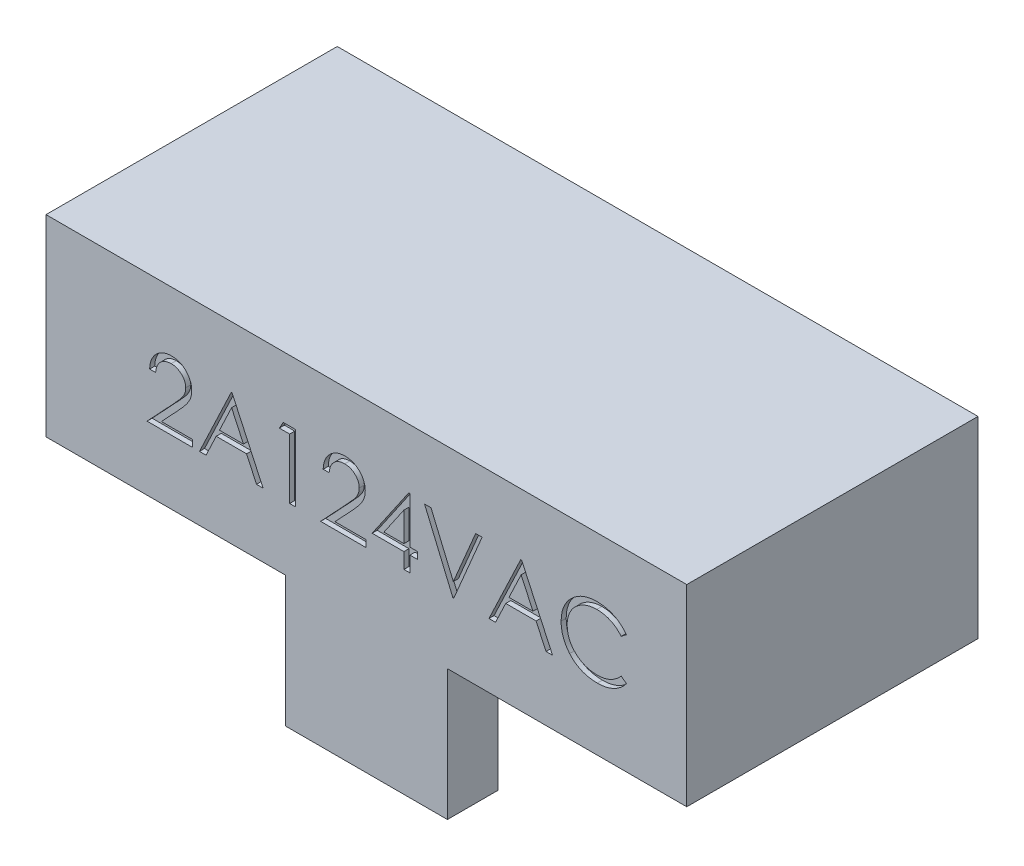
from build123d import *

# Parameters (mm, degrees)
SKETCH1_W      = 12.65
SKETCH1_H      = 3.8
EXTRUDE1_DEPTH = 5.75
SKETCH2_W      = 3.2
SKETCH2_H      = 2.58
EXTRUDE2_DEPTH = 1
SKETCH3_W      = 3.2
SKETCH3_H      = 2.58
EXTRUDE3_DEPTH = 1
WRAP1_START    = -4.1
WRAP1_DEPTH    = 0.1


# Read off the part's stored shape, not the designer's step: Wrap1
with BuildPart() as part:
    # Sketch1 → Extrude1 (new body)
    with BuildSketch(Plane.XY):
        Rectangle(SKETCH1_W, SKETCH1_H)
    extrude(amount=EXTRUDE1_DEPTH)

    # Sketch2 → Extrude2 (add)
    with BuildSketch(Plane.XY.offset(5.75)):
        with Locations((0, -3.19)):
            Rectangle(SKETCH2_W, SKETCH2_H)
    extrude(amount=-EXTRUDE2_DEPTH)

    # Sketch3 → Extrude3 (add)
    with BuildSketch(Plane(origin=(0, 0, 0), x_dir=(-1, 0, 0), z_dir=(0, 0, -1))):
        with Locations((0, -3.19)):
            Rectangle(SKETCH3_W, SKETCH3_H)
    extrude(amount=-EXTRUDE3_DEPTH)

    # Wrap1 outline → Wrap1 (cut)
    # profile 1 of 8: a face of its own
    with BuildSketch(Plane.XY.offset(9.75).offset(WRAP1_START)):
        with BuildLine():
            add(Edge.make_bspline(
                [(-4.279021285, 0.28237644), (-4.27824751, 0.298127044), (-4.276727836, 0.32906081), (-4.269611191, 0.374162405), (-4.259428181, 0.417272403), (-4.245030518, 0.458044663), (-4.227149872, 0.496839688), (-4.205707272, 0.533503384), (-4.180309596, 0.567895887), (-4.151505265, 0.599698367), (-4.12022069, 0.628873431), (-4.086465172, 0.654067525), (-4.050993986, 0.675354264), (-4.013914749, 0.693149853), (-3.974809119, 0.706507473), (-3.934031967, 0.716418629), (-3.891404139, 0.722381712), (-3.86236044, 0.723022678), (-3.847589327, 0.723348662)],
                knots=[0, 0, 0, 0, 0.068790794, 0.135103289, 0.198978674, 0.2619043, 0.323494969, 0.385195378, 0.446969239, 0.509764777, 0.572250569, 0.633405176, 0.693251163, 0.752583163, 0.812579266, 0.873275085, 0.935549943, 1, 1, 1, 1], degree=3))
            Line((-4.279021285, 0.28237644), (-4.160297994, 0.28237644))
            add(Edge.make_bspline(
                [(-3.853684496, 0.587664902), (-3.864030019, 0.587394637), (-3.884346918, 0.58686388), (-3.914176434, 0.583151147), (-3.942632665, 0.576746023), (-3.969787194, 0.567985792), (-3.995685966, 0.556851162), (-4.02020303, 0.542982556), (-4.043283348, 0.526433438), (-4.064970308, 0.50767049), (-4.084951634, 0.486780652), (-4.102507447, 0.463493553), (-4.117847238, 0.438234381), (-4.131231085, 0.411071292), (-4.142100051, 0.38175781), (-4.150405379, 0.350397993), (-4.156977193, 0.317128007), (-4.159172675, 0.294152692), (-4.160297994, 0.28237644)],
                knots=[0, 0, 0, 0, 0.064438672, 0.126546911, 0.186887153, 0.245877536, 0.304040885, 0.362191218, 0.420975933, 0.480660283, 0.540600275, 0.600689098, 0.66193579, 0.724442506, 0.789038394, 0.856313757, 0.926352028, 1, 1, 1, 1], degree=3))
            add(Edge.make_bspline(
                [(-3.566681541, 0.319477469), (-3.566921837, 0.328504069), (-3.567395413, 0.346293764), (-3.571574959, 0.372376298), (-3.577891133, 0.397536212), (-3.58694187, 0.421850899), (-3.598888465, 0.445075892), (-3.613430487, 0.467239464), (-3.630208874, 0.488666543), (-3.649618431, 0.508757224), (-3.670940643, 0.52715756), (-3.69346585, 0.543457438), (-3.717297288, 0.557079364), (-3.742334477, 0.568246102), (-3.768507616, 0.577005845), (-3.795867326, 0.583075605), (-3.824338011, 0.586886544), (-3.843778648, 0.587402169), (-3.853684496, 0.587664902)],
                knots=[0, 0, 0, 0, 0.061965401, 0.122121906, 0.180988497, 0.239933216, 0.299905831, 0.359988847, 0.421775742, 0.486575826, 0.551534805, 0.615017543, 0.677258617, 0.739729962, 0.803050103, 0.866495132, 0.931973474, 1, 1, 1, 1], degree=3))
            add(Edge.make_bspline(
                [(-3.816848475, -0.085983769), (-3.804357161, -0.072944231), (-3.780363902, -0.047897946), (-3.746428226, -0.011331411), (-3.715948608, 0.022591779), (-3.688727749, 0.053807528), (-3.665356156, 0.082772436), (-3.644615759, 0.10854841), (-3.627997812, 0.132268098), (-3.609962528, 0.159762318), (-3.592494744, 0.19333126), (-3.577484419, 0.23435441), (-3.568331783, 0.276584651), (-3.567233824, 0.305122624), (-3.566681541, 0.319477469)],
                knots=[0, 0, 0, 0, 0.110802644, 0.212829202, 0.30610131, 0.390647321, 0.466924469, 0.534481039, 0.593586941, 0.644557005, 0.736200453, 0.825024026, 0.911985585, 1, 1, 1, 1], degree=3))
            Line((-3.816848475, -0.085983769), (-4.329902695, -0.633488944))
            Line((-4.329902695, -0.633488944), (-3.430997781, -0.633488944))
            Line((-3.430997781, -0.633488944), (-3.430997781, -0.497805184))
            Line((-3.430997781, -0.497805184), (-4.046609843, -0.497805184))
            Line((-4.046609843, -0.497805184), (-3.715615669, -0.144550393))
            add(Edge.make_bspline(
                [(-3.447958251, 0.330077762), (-3.448598264, 0.311652242), (-3.449867059, 0.275124542), (-3.460720409, 0.221446305), (-3.477671323, 0.169439269), (-3.498081038, 0.127583205), (-3.518670325, 0.093855069), (-3.537224234, 0.066085648), (-3.558944564, 0.036185664), (-3.584147449, 0.004255242), (-3.61231154, -0.029955725), (-3.643691941, -0.06642657), (-3.678512424, -0.104780483), (-3.702951798, -0.130976351), (-3.715615669, -0.144550393)],
                knots=[0, 0, 0, 0, 0.098702196, 0.195672309, 0.292422427, 0.391342544, 0.444462441, 0.504228775, 0.570352338, 0.642545753, 0.722287505, 0.807921123, 0.900469538, 1, 1, 1, 1], degree=3))
            add(Edge.make_bspline(
                [(-3.847589327, 0.723348662), (-3.833083329, 0.723009067), (-3.804579561, 0.722341775), (-3.76297874, 0.716611267), (-3.723375417, 0.707635999), (-3.685847005, 0.695043564), (-3.650692927, 0.678116117), (-3.617649098, 0.657781928), (-3.586322125, 0.634264314), (-3.558122537, 0.606576116), (-3.532228114, 0.577017477), (-3.509888869, 0.545461037), (-3.490758298, 0.51286842), (-3.47481236, 0.478991094), (-3.463073879, 0.44351008), (-3.454161877, 0.406941941), (-3.449124432, 0.368908158), (-3.448351311, 0.343165502), (-3.447958251, 0.330077762)],
                knots=[0, 0, 0, 0, 0.06947546, 0.136516798, 0.200788824, 0.263829673, 0.325735023, 0.387290692, 0.449509219, 0.51296782, 0.576275215, 0.6375801, 0.697902606, 0.757172088, 0.816598528, 0.876653171, 0.937289642, 1, 1, 1, 1], degree=3))
        make_face()
    # profile 2 of 8: a face of its own
    with BuildSketch(Plane.XY.offset(9.75).offset(WRAP1_START)):
        with BuildLine():
            add(Edge.make_bspline(
                [(-0.853006328, 0.28237644), (-0.852232553, 0.298127044), (-0.850712879, 0.32906081), (-0.843596234, 0.374162405), (-0.833413224, 0.417272403), (-0.819015561, 0.458044663), (-0.801134914, 0.496839688), (-0.779692315, 0.533503384), (-0.754294639, 0.567895887), (-0.725490308, 0.599698367), (-0.694205733, 0.628873431), (-0.660450214, 0.654067525), (-0.624979028, 0.675354264), (-0.587899791, 0.693149853), (-0.548794162, 0.706507473), (-0.50801701, 0.716418629), (-0.465389182, 0.722381712), (-0.436345483, 0.723022678), (-0.42157437, 0.723348662)],
                knots=[0, 0, 0, 0, 0.068790794, 0.135103289, 0.198978674, 0.2619043, 0.323494969, 0.385195378, 0.446969239, 0.509764777, 0.572250569, 0.633405176, 0.693251163, 0.752583163, 0.812579266, 0.873275085, 0.935549943, 1, 1, 1, 1], degree=3))
            Line((-0.853006328, 0.28237644), (-0.734283037, 0.28237644))
            add(Edge.make_bspline(
                [(-0.427669539, 0.587664902), (-0.438015062, 0.587394637), (-0.458331961, 0.58686388), (-0.488161476, 0.583151147), (-0.516617708, 0.576746023), (-0.543772237, 0.567985792), (-0.569671009, 0.556851162), (-0.594188073, 0.542982556), (-0.617268391, 0.526433438), (-0.638955351, 0.50767049), (-0.658936676, 0.486780652), (-0.67649249, 0.463493553), (-0.691832281, 0.438234381), (-0.705216128, 0.411071292), (-0.716085094, 0.38175781), (-0.724390422, 0.350397993), (-0.730962236, 0.317128007), (-0.733157718, 0.294152692), (-0.734283037, 0.28237644)],
                knots=[0, 0, 0, 0, 0.064438672, 0.126546911, 0.186887153, 0.245877536, 0.304040885, 0.362191218, 0.420975933, 0.480660283, 0.540600275, 0.600689098, 0.66193579, 0.724442506, 0.789038394, 0.856313757, 0.926352028, 1, 1, 1, 1], degree=3))
            add(Edge.make_bspline(
                [(-0.140666584, 0.319477469), (-0.14090688, 0.328504069), (-0.141380456, 0.346293764), (-0.145560002, 0.372376298), (-0.151876176, 0.397536212), (-0.160926913, 0.421850899), (-0.172873508, 0.445075892), (-0.18741553, 0.467239464), (-0.204193917, 0.488666543), (-0.223603474, 0.508757224), (-0.244925685, 0.52715756), (-0.267450893, 0.543457438), (-0.291282331, 0.557079364), (-0.31631952, 0.568246102), (-0.342492659, 0.577005845), (-0.369852369, 0.583075605), (-0.398323054, 0.586886544), (-0.41776369, 0.587402169), (-0.427669539, 0.587664902)],
                knots=[0, 0, 0, 0, 0.061965401, 0.122121906, 0.180988497, 0.239933216, 0.299905831, 0.359988847, 0.421775742, 0.486575826, 0.551534805, 0.615017543, 0.677258617, 0.739729962, 0.803050103, 0.866495132, 0.931973474, 1, 1, 1, 1], degree=3))
            add(Edge.make_bspline(
                [(-0.390833518, -0.085983769), (-0.378342203, -0.072944231), (-0.354348945, -0.047897946), (-0.320413269, -0.011331411), (-0.289933651, 0.022591779), (-0.262712791, 0.053807528), (-0.239341198, 0.082772436), (-0.218600801, 0.10854841), (-0.201982855, 0.132268098), (-0.183947571, 0.159762318), (-0.166479787, 0.19333126), (-0.151469462, 0.23435441), (-0.142316825, 0.276584651), (-0.141218867, 0.305122624), (-0.140666584, 0.319477469)],
                knots=[0, 0, 0, 0, 0.110802644, 0.212829202, 0.30610131, 0.390647321, 0.466924469, 0.534481039, 0.593586941, 0.644557005, 0.736200453, 0.825024026, 0.911985585, 1, 1, 1, 1], degree=3))
            Line((-0.390833518, -0.085983769), (-0.903887738, -0.633488944))
            Line((-0.903887738, -0.633488944), (-0.004982823, -0.633488944))
            Line((-0.004982823, -0.633488944), (-0.004982823, -0.497805184))
            Line((-0.004982823, -0.497805184), (-0.620594886, -0.497805184))
            Line((-0.620594886, -0.497805184), (-0.289600712, -0.144550393))
            add(Edge.make_bspline(
                [(-0.021943293, 0.330077762), (-0.022583307, 0.311652242), (-0.023852101, 0.275124542), (-0.034705452, 0.221446305), (-0.051656365, 0.169439269), (-0.072066081, 0.127583205), (-0.092655367, 0.093855069), (-0.111209277, 0.066085648), (-0.132929607, 0.036185664), (-0.158132492, 0.004255242), (-0.186296583, -0.029955725), (-0.217676984, -0.06642657), (-0.252497467, -0.104780483), (-0.276936841, -0.130976351), (-0.289600712, -0.144550393)],
                knots=[0, 0, 0, 0, 0.098702196, 0.195672309, 0.292422427, 0.391342544, 0.444462441, 0.504228775, 0.570352338, 0.642545753, 0.722287505, 0.807921123, 0.900469538, 1, 1, 1, 1], degree=3))
            add(Edge.make_bspline(
                [(-0.42157437, 0.723348662), (-0.407068372, 0.723009067), (-0.378564603, 0.722341775), (-0.336963782, 0.716611267), (-0.29736046, 0.707635999), (-0.259832048, 0.695043564), (-0.22467797, 0.678116117), (-0.191634141, 0.657781928), (-0.160307167, 0.634264314), (-0.13210758, 0.606576116), (-0.106213157, 0.577017477), (-0.083873912, 0.545461037), (-0.064743341, 0.51286842), (-0.048797402, 0.478991094), (-0.037058921, 0.44351008), (-0.02814692, 0.406941941), (-0.023109475, 0.368908158), (-0.022336354, 0.343165502), (-0.021943293, 0.330077762)],
                knots=[0, 0, 0, 0, 0.06947546, 0.136516798, 0.200788824, 0.263829673, 0.325735023, 0.387290692, 0.449509219, 0.51296782, 0.576275215, 0.6375801, 0.697902606, 0.757172088, 0.816598528, 0.876653171, 0.937289642, 1, 1, 1, 1], degree=3))
        make_face()
    # profile 3 of 8: a face of its own
    with BuildSketch(Plane.XY.offset(9.75).offset(WRAP1_START)):
        with BuildLine():
            add(Edge.make_bspline(
                [(5.030156733, 0.367178791), (5.022746174, 0.376010571), (5.008024967, 0.39355506), (4.98434128, 0.418191376), (4.959658814, 0.441272591), (4.933987003, 0.462908658), (4.906863764, 0.482342972), (4.878946141, 0.500588299), (4.849767118, 0.516942474), (4.809417504, 0.536772234), (4.756633942, 0.557464977), (4.690187679, 0.574815305), (4.620824853, 0.585860214), (4.573503141, 0.587056449), (4.549433409, 0.587664902)],
                knots=[0, 0, 0, 0, 0.063163259, 0.125474941, 0.18712122, 0.248294346, 0.309294856, 0.369850066, 0.430973376, 0.49245599, 0.616147966, 0.740843698, 0.868182649, 1, 1, 1, 1], degree=3))
            Line((5.030156733, 0.367178791), (5.134039613, 0.446680994))
            add(Edge.make_bspline(
                [(4.556853615, 0.723348662), (4.572053728, 0.723166426), (4.602140821, 0.722805706), (4.64664852, 0.719288206), (4.68998059, 0.713424432), (4.732166883, 0.705443061), (4.773412634, 0.695537317), (4.813402606, 0.682633097), (4.852371455, 0.667878218), (4.890073411, 0.650884988), (4.926327584, 0.631809762), (4.96112268, 0.610863975), (4.994182314, 0.588073597), (5.025739111, 0.563632456), (5.055265179, 0.537023477), (5.083598833, 0.508978552), (5.109777872, 0.478689874), (5.125937561, 0.457370152), (5.134039613, 0.446680994)],
                knots=[0, 0, 0, 0, 0.068547537, 0.135682946, 0.20121499, 0.265682235, 0.329266835, 0.392395428, 0.455069762, 0.51712685, 0.578790035, 0.639739863, 0.700191504, 0.759806243, 0.819628319, 0.879354791, 0.939511608, 1, 1, 1, 1], degree=3))
            add(Edge.make_bspline(
                [(3.845043886, 0.035654602), (3.845631712, 0.059450264), (3.846788223, 0.106266745), (3.856614015, 0.174972971), (3.872420524, 0.240798054), (3.894871134, 0.303619112), (3.923334764, 0.363766569), (3.958496609, 0.420780953), (3.999948178, 0.475026886), (4.047364371, 0.525681271), (4.099361549, 0.571998229), (4.155044553, 0.612746407), (4.214304396, 0.646657492), (4.276488227, 0.675004256), (4.342061684, 0.69679249), (4.410884862, 0.712045034), (4.48282844, 0.721538706), (4.531913345, 0.722738859), (4.556853615, 0.723348662)],
                knots=[0, 0, 0, 0, 0.064557846, 0.127013532, 0.18795481, 0.248013913, 0.307747682, 0.368234515, 0.429469844, 0.492743437, 0.556257769, 0.618216786, 0.679655476, 0.741245546, 0.803415265, 0.866815462, 0.932328312, 1, 1, 1, 1], degree=3))
            add(Edge.make_bspline(
                [(4.012793535, -0.436058472), (3.999399706, -0.41960094), (3.972773749, -0.386884564), (3.938708386, -0.333859803), (3.909548447, -0.278498308), (3.885971834, -0.220509227), (3.867540682, -0.160022685), (3.854772195, -0.09700819), (3.846475011, -0.031524593), (3.845526182, 0.013014908), (3.845043886, 0.035654602)],
                knots=[0, 0, 0, 0, 0.12432851, 0.247156016, 0.368779749, 0.490733862, 0.613613772, 0.738957576, 0.867310575, 1, 1, 1, 1], degree=3))
            add(Edge.make_bspline(
                [(4.558443659, -0.667409885), (4.544215249, -0.667310858), (4.516080331, -0.667115044), (4.474541219, -0.663943005), (4.434101705, -0.659615277), (4.394877367, -0.653098918), (4.356654156, -0.645409241), (4.319778578, -0.635101356), (4.28388777, -0.623554498), (4.249125927, -0.609983268), (4.21546348, -0.594669116), (4.183009004, -0.577360997), (4.151777424, -0.558204459), (4.121461685, -0.537621761), (4.092509622, -0.514951769), (4.064670343, -0.490509321), (4.03778774, -0.464376799), (4.021155773, -0.445532852), (4.012793535, -0.436058472)],
                knots=[0, 0, 0, 0, 0.069662801, 0.137749562, 0.203916744, 0.268779862, 0.332413706, 0.39475354, 0.456180032, 0.516995649, 0.577395938, 0.637198344, 0.696999184, 0.756756194, 0.816553905, 0.876947997, 0.938131788, 1, 1, 1, 1], degree=3))
            add(Edge.make_bspline(
                [(5.134039613, -0.389947194), (5.125679494, -0.40073405), (5.1089993, -0.422256092), (5.081989871, -0.452596887), (5.053536845, -0.481135615), (5.023428883, -0.507642186), (4.992012337, -0.532646999), (4.9587231, -0.555439655), (4.923998793, -0.576338293), (4.88795707, -0.595474065), (4.850636226, -0.612451715), (4.812080978, -0.626986324), (4.772457516, -0.639506743), (4.73176403, -0.649807326), (4.68991611, -0.65784729), (4.64706477, -0.663221988), (4.603117525, -0.6669042), (4.573468536, -0.667239811), (4.558443659, -0.667409885)],
                knots=[0, 0, 0, 0, 0.061674239, 0.123053062, 0.183475001, 0.243726501, 0.304278917, 0.364862921, 0.425946204, 0.48739123, 0.549220384, 0.611143589, 0.67352853, 0.736961457, 0.800785283, 0.866012596, 0.932100748, 1, 1, 1, 1], degree=3))
            Line((5.134039613, -0.389947194), (5.030156733, -0.311240013))
            add(Edge.make_bspline(
                [(4.557648637, -0.531726124), (4.580743999, -0.531087805), (4.626201195, -0.529831442), (4.69286411, -0.519187916), (4.756680009, -0.50193031), (4.817652326, -0.477778417), (4.875609172, -0.446381716), (4.930641243, -0.408320316), (4.982794991, -0.363232166), (5.01415616, -0.328804912), (5.030156733, -0.311240013)],
                knots=[0, 0, 0, 0, 0.12851519, 0.252948636, 0.374754734, 0.495939754, 0.617180641, 0.740909469, 0.867811148, 1, 1, 1, 1], degree=3))
            add(Edge.make_bspline(
                [(3.963767177, 0.026644352), (3.964244114, 0.007091145), (3.965180518, -0.031298984), (3.973514263, -0.087530732), (3.98617839, -0.141400154), (4.005158682, -0.192570511), (4.028562609, -0.241672777), (4.058135697, -0.287876153), (4.092386591, -0.331878843), (4.131799839, -0.372640909), (4.175042513, -0.409876752), (4.221438301, -0.442666406), (4.270871648, -0.46999971), (4.322796744, -0.492744785), (4.377613162, -0.510228727), (4.435222328, -0.52253719), (4.495498945, -0.530566229), (4.536686784, -0.531334914), (4.557648637, -0.531726124)],
                knots=[0, 0, 0, 0, 0.064323217, 0.126290104, 0.186726469, 0.246146432, 0.305575643, 0.365429386, 0.426326309, 0.488839906, 0.551724972, 0.613918596, 0.675483766, 0.737333897, 0.800229044, 0.864502298, 0.931040739, 1, 1, 1, 1], degree=3))
            add(Edge.make_bspline(
                [(4.549433409, 0.587664902), (4.536172757, 0.587512214), (4.509774525, 0.587208254), (4.47059787, 0.583198257), (4.432152758, 0.577562175), (4.394464198, 0.56919933), (4.357580163, 0.558626346), (4.321259523, 0.545992335), (4.286028136, 0.53036119), (4.251398623, 0.513084556), (4.218220171, 0.493570611), (4.186827341, 0.472285505), (4.157334627, 0.449467424), (4.129718699, 0.425030845), (4.103951326, 0.399085818), (4.080219217, 0.371355844), (4.058604494, 0.341929576), (4.038678713, 0.311195044), (4.020833424, 0.279241772), (4.005892071, 0.245951492), (3.992660968, 0.211894287), (3.982191314, 0.176685366), (3.973904369, 0.140572475), (3.968186472, 0.103458695), (3.96422208, 0.06542156), (3.963919632, 0.039640064), (3.963767177, 0.026644352)],
                knots=[0, 0, 0, 0, 0.043954909, 0.087501875, 0.130462627, 0.172752021, 0.215403067, 0.25764983, 0.300152749, 0.34312149, 0.385925163, 0.427685727, 0.46881795, 0.5094918, 0.549883031, 0.589980023, 0.63040523, 0.670868626, 0.711383944, 0.751627258, 0.791775577, 0.832458919, 0.873319045, 0.914542956, 0.956923558, 1, 1, 1, 1], degree=3))
        make_face()
    # profile 4 of 8: a face of its own
    with BuildSketch(Plane.XY.offset(9.75).offset(WRAP1_START)):
        Polygon((-2.169297811, -0.633488944), (-2.040239234, -0.633488944), (-2.650816157, 0.689427722), (-2.667776627, 0.689427722), (-3.29531402, -0.633488944), (-3.165725428, -0.633488944), (-2.964584853, -0.209477192), (-2.364873231, -0.209477192), align=None)
        Polygon((-2.427414965, -0.073793432), (-2.900188068, -0.073793432), (-2.660621428, 0.431575576), align=None, mode=Mode.SUBTRACT)
    # profile 5 of 8: a face of its own
    with BuildSketch(Plane.XY.offset(9.75).offset(WRAP1_START)):
        Polygon((-1.514464661, -0.633488944), (-1.39574137, -0.633488944), (-1.39574137, 0.689427722), (-1.64034315, 0.689427722), (-1.717990302, 0.553743962), (-1.514464661, 0.553743962), align=None)
    # profile 6 of 8: a face of its own
    with BuildSketch(Plane.XY.offset(9.75).offset(WRAP1_START)):
        Polygon((0.74127786, -0.633488944), (0.860001151, -0.633488944), (0.860001151, -0.328200483), (1.012645382, -0.328200483), (1.012645382, -0.192516722), (0.860001151, -0.192516722), (0.860001151, 0.723348662), (0.835885483, 0.723348662), (0.113740467, -0.328200483), (0.74127786, -0.328200483), align=None)
        Polygon((0.74127786, -0.192516722), (0.346946931, -0.192516722), (0.74127786, 0.382019202), align=None, mode=Mode.SUBTRACT)
    # profile 7 of 8: a face of its own
    with BuildSketch(Plane.XY.offset(9.75).offset(WRAP1_START)):
        Polygon((1.708024655, -0.633488944), (1.724985125, -0.633488944), (2.284680638, 0.689427722), (2.157477113, 0.689427722), (1.71650489, -0.353111173), (1.275532668, 0.689427722), (1.148329142, 0.689427722), align=None)
    # profile 8 of 8: a face of its own
    with BuildSketch(Plane.XY.offset(9.75).offset(WRAP1_START)):
        Polygon((3.546380608, -0.633488944), (3.675439185, -0.633488944), (3.064862262, 0.689427722), (3.047901792, 0.689427722), (2.420364399, -0.633488944), (2.549952991, -0.633488944), (2.751093566, -0.209477192), (3.350805187, -0.209477192), align=None)
        Polygon((3.288263454, -0.073793432), (2.81549035, -0.073793432), (3.05505699, 0.431575576), align=None, mode=Mode.SUBTRACT)
    extrude(amount=WRAP1_DEPTH, mode=Mode.SUBTRACT)


solid = part.part
